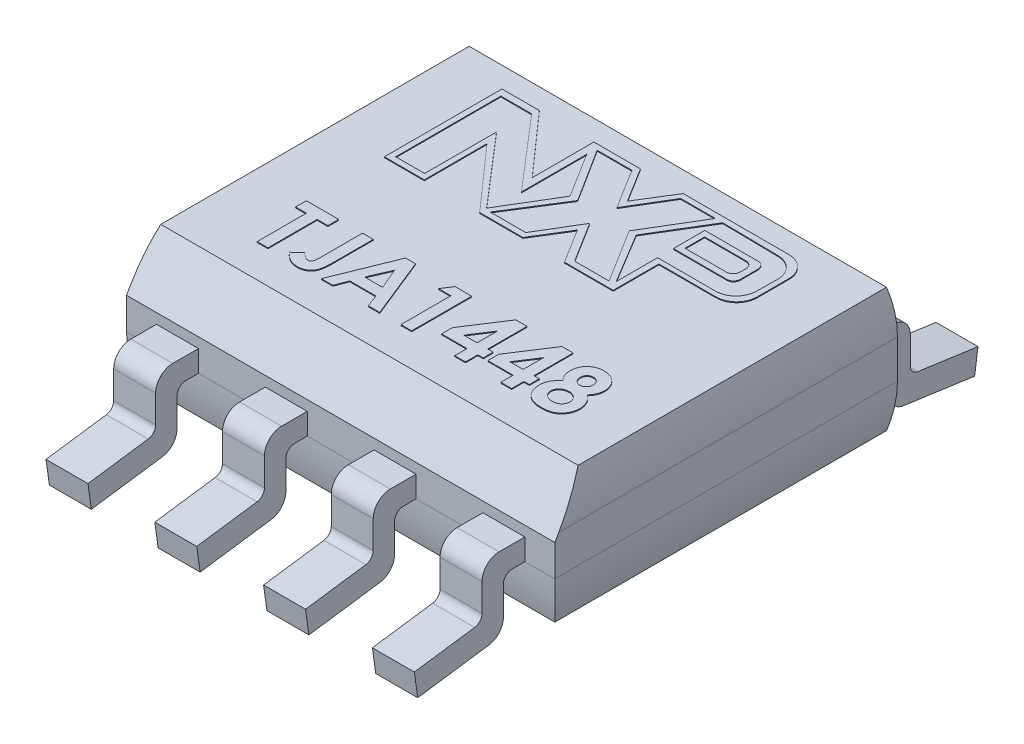
from build123d import *
from OCP.BRepAlgoAPI import BRepAlgoAPI_Cut
from OCP.TopTools import TopTools_ListOfShape

# Parameters (mm, degrees)
SKETCH1_W           = 5
SKETCH1_H           = 4
BOSS_EXTRUDE1_DEPTH = 1.45
CUT_EXTRUDE1_DEPTH  = 61.45
CUT_EXTRUDE2_DEPTH  = 61.45
BOSS_EXTRUDE2_DEPTH = 5
SKETCH7_W           = 0.35
SKETCH7_H           = 1.533953372
SKETCH7_W_2         = 0.78
SKETCH7_H_2         = 1.610570248
SKETCH7_H_3         = 1.782958217
SKETCH7_H_4         = 1.677610014
CUT_EXTRUDE3_DEPTH  = 61.45
BOSS_EXTRUDE3_DEPTH = 0.01
BOSS_EXTRUDE4_DEPTH = 0.01


with BuildPart() as part:
    # Sketch1 → Boss-Extrude1 (new body)
    with BuildSketch(Plane(origin=(0, 0, 0), x_dir=(1, 0, 0), z_dir=(0, 1, 0))):
        Rectangle(SKETCH1_W, SKETCH1_H)
    extrude(amount=BOSS_EXTRUDE1_DEPTH)

    # Sketch2 → Cut-Extrude1 (cut)
    with BuildSketch(Plane.ZY.offset(2.5)):
        Polygon((2, 0.86865368), (1.664359546, 1.45), (1.664359546, 1.731681291), (2.487143748, 1.731681291), (2.487143748, 0.86865368), align=None)
        with BuildLine():
            Line((-1.864420937, 1.672264495), (-2.155873567, 1.672264495))
            Line((-2.155873567, 1.672264495), (-2.155873567, 0.954004167))
            Line((-2.155873567, 0.954004167), (-1.999984404, 0.948389144))
            ThreePointArc((-1.999984404, 0.948389144), (-1.965805293, 1.316619369), (-1.864420937, 1.672264495))
        make_face()
        with BuildLine():
            Line((-1.999984404, 0.501610856), (-2.15587357, 0.501610856))
            Line((-2.15587357, 0.501610856), (-2.15587357, -0.22229559))
            Line((-2.15587357, -0.22229559), (-1.864420937, -0.222264495))
            ThreePointArc((-1.864420937, -0.222264495), (-1.965805293, 0.133380631), (-1.999984404, 0.501610856))
        make_face()
        with BuildLine():
            Line((2, 0.501548667), (2.487143748, 0.501548667))
            Line((2.487143748, 0.501548667), (2.487143748, -0.222291374))
            Line((2.487143748, -0.222291374), (1.864414025, -0.222322469))
            ThreePointArc((1.864414025, -0.222322469), (1.965809439, 0.133319505), (2, 0.501548667))
        make_face()
    extrude(amount=-CUT_EXTRUDE1_DEPTH, mode=Mode.SUBTRACT)


with BuildPart() as cut_extrude2_tool:
    # Sketch5 → Cut-Extrude2 (new body)
    with BuildSketch(Plane(origin=(0, 0, -2), x_dir=(-1, 0, 0), z_dir=(0, 0, -1))):
        with BuildLine():
            Line((-2.655873567, 0.954004878), (-2.499991937, 0.948390126))
            ThreePointArc((-2.499991937, 0.948390126), (-2.46581276, 1.316621068), (-2.364420937, 1.672264066))
            Line((-2.364420937, 1.672264066), (-2.655873567, 1.672264066))
            Line((-2.655873567, 1.672264066), (-2.655873567, 0.954004878))
        make_face()
        with BuildLine():
            ThreePointArc((-2.364420937, -0.222263785), (-2.46581276, 0.133379212), (-2.499991937, 0.501610155))
            Line((-2.499991937, 0.501610155), (-2.655873567, 0.495995403))
            Line((-2.65587357, 0.495995403), (-2.65587357, -0.22229488))
            Line((-2.65587357, -0.22229488), (-2.364420937, -0.222263785))
        make_face()
        with BuildLine():
            ThreePointArc((2.499991937, 0.948390126), (2.46581276, 1.316621068), (2.364420937, 1.672264066))
            Line((2.364420937, 1.672264066), (2.655873567, 1.672264066))
            Line((2.655873567, 1.672264066), (2.655873567, 0.954004878))
            Line((2.655873567, 0.954004878), (2.499991937, 0.948390126))
        make_face()
        with BuildLine():
            Line((2.499991937, 0.501610155), (2.65587357, 0.501610155))
            Line((2.65587357, 0.501610155), (2.65587357, -0.22229488))
            Line((2.65587357, -0.22229488), (2.364420937, -0.222263785))
            ThreePointArc((2.364420937, -0.222263785), (2.46581276, 0.133379212), (2.499991937, 0.501610155))
        make_face()
    extrude(amount=-CUT_EXTRUDE2_DEPTH)


with BuildPart() as part_1:
    add(part.part)

    # Cut-Extrude2: cut by cut_extrude2_tool, with a tolerance
    cut_extrude2_stock = TopTools_ListOfShape()
    cut_extrude2_stock.Append(part_1.part.wrapped)
    cut_extrude2_tools = TopTools_ListOfShape()
    cut_extrude2_tools.Append(cut_extrude2_tool.part.wrapped)
    cut_extrude2_cut = BRepAlgoAPI_Cut()
    cut_extrude2_cut.SetArguments(cut_extrude2_stock)
    cut_extrude2_cut.SetTools(cut_extrude2_tools)
    cut_extrude2_cut.SetFuzzyValue(0.00001)
    cut_extrude2_cut.Build()
    add(Compound.cast(cut_extrude2_cut.Shape()).solids(), mode=Mode.REPLACE)

    # Sketch6 → Boss-Extrude2 (add)
    with BuildSketch(Plane.ZY.offset(2.5)):
        with BuildLine():
            Line((2.300001958, 0.75), (2.253544498, 0.75))
            Line((2.253544498, 0.75), (-2.253544498, 0.75))
            Line((-2.253544498, 0.75), (-2.300001958, 0.75))
            ThreePointArc((-2.300001958, 0.75), (-2.441423314, 0.691421356), (-2.500001958, 0.55))
            Line((-2.500001958, 0.55), (-2.500001958, 0.227578594))
            ThreePointArc((-2.500001958, 0.227578594), (-2.524531, 0.161972691), (-2.586084648, 0.128551787))
            Line((-2.586084648, 0.128551787), (-3.290075098, 0.029612381))
            Line((-3.290075098, 0.029612381), (-3.250778141, -0.25))
            Line((-3.250778141, -0.25), (-2.422167338, -0.133546346))
            ThreePointArc((-2.422167338, -0.133546346), (-2.299060042, -0.066704538), (-2.250001958, 0.064507268))
            Line((-2.250001958, 0.064507268), (-2.250001958, 0.4))
            ThreePointArc((-2.250001958, 0.4), (-2.220712636, 0.470710678), (-2.150001958, 0.5))
            Line((-2.150001958, 0.5), (2.150001958, 0.5))
            ThreePointArc((2.150001958, 0.5), (2.220712636, 0.470710678), (2.250001958, 0.4))
            Line((2.250001958, 0.4), (2.250001958, 0.064507268))
            ThreePointArc((2.250001958, 0.064507268), (2.299060042, -0.066704538), (2.422167338, -0.133546346))
            Line((2.422167338, -0.133546346), (3.250778141, -0.25))
            Line((3.250778141, -0.25), (3.290075098, 0.029612381))
            Line((3.290075098, 0.029612381), (2.586084648, 0.128551787))
            ThreePointArc((2.586084648, 0.128551787), (2.524531, 0.161972691), (2.500001958, 0.227578594))
            Line((2.500001958, 0.227578594), (2.500001958, 0.55))
            ThreePointArc((2.500001958, 0.55), (2.441423314, 0.691421356), (2.300001958, 0.75))
        make_face()
    extrude(amount=-BOSS_EXTRUDE2_DEPTH)

    # Sketch7 → Cut-Extrude3 (cut)
    with BuildSketch(Plane(origin=(0, 1.45, 0), x_dir=(1, 0, 0), z_dir=(0, 1, 0))):
        with Locations((-2.325, -2.766976686)):
            Rectangle(SKETCH7_W, SKETCH7_H)
        with Locations((-1.27, -2.805285124)):
            Rectangle(SKETCH7_W_2, SKETCH7_H_2)
        with Locations((0, -2.805285124)):
            Rectangle(SKETCH7_W_2, SKETCH7_H_2)
        with Locations((2.325, -2.891479109)):
            Rectangle(SKETCH7_W, SKETCH7_H_3)
        with Locations((1.27, -2.838805007)):
            Rectangle(SKETCH7_W_2, SKETCH7_H_4)
        with Locations((1.27, 2.838805007)):
            Rectangle(SKETCH7_W_2, SKETCH7_H_4)
        with Locations((2.325, 2.891479109)):
            Rectangle(SKETCH7_W, SKETCH7_H_3)
        with Locations((0, 2.805285124)):
            Rectangle(SKETCH7_W_2, SKETCH7_H_2)
        with Locations((-1.27, 2.805285124)):
            Rectangle(SKETCH7_W_2, SKETCH7_H_2)
        with Locations((-2.325, 2.766976686)):
            Rectangle(SKETCH7_W, SKETCH7_H)
    extrude(amount=-CUT_EXTRUDE3_DEPTH, mode=Mode.SUBTRACT)

    # Sketch8 → Boss-Extrude3 (add)
    # profile 1 of 2: a face of its own
    with BuildSketch(Plane(origin=(0, 1.45, 0), x_dir=(1, 0, 0), z_dir=(0, 1, 0))):
        with BuildLine():
            Line((-1.803375496, 0.313929244), (-1.803375496, 1.686128651))
            Line((-1.803375496, 1.686128651), (-1.367177563, 1.686128651))
            Line((-1.367177563, 1.686128651), (-0.729512855, 0.965015135))
            Line((-0.729512855, 0.965015135), (-0.729512855, 1.686128651))
            Line((-0.729512855, 1.686128651), (-0.186049825, 1.686128651))
            Line((-0.186049825, 1.686128651), (0.063647762, 1.28357467))
            Line((0.063647762, 1.28357467), (0.31227987, 1.686128651))
            Line((0.31227987, 1.686128651), (1.548664193, 1.686128651))
            ThreePointArc((1.548664193, 1.686128651), (1.71836982, 1.615834278), (1.788664193, 1.446128651))
            Line((1.788664193, 1.446128651), (1.788664193, 1.073244082))
            ThreePointArc((1.788664193, 1.073244082), (1.71836982, 0.903538454), (1.548664193, 0.833244082))
            Line((1.548664193, 0.833244082), (0.881704624, 0.833244082))
            Line((0.881704624, 0.833244082), (0.881704624, 0.299873291))
            Line((0.881704624, 0.299873291), (0.31227987, 0.299873291))
            Line((0.31227987, 0.299873291), (0.063647762, 0.700709541))
            Line((0.063647762, 0.700709541), (-0.179553334, 0.306948774))
            Line((-0.179553334, 0.306948774), (-0.684190472, 0.306948774))
            Line((-0.684190472, 0.306948774), (-1.337736001, 1.046021375))
            Line((-1.337736001, 1.046021375), (-1.337736001, 0.313929244))
            Line((-1.337736001, 0.313929244), (-1.803375496, 0.313929244))
        make_face()
        Polygon((-1.737717167, 0.380080618), (-1.737717167, 1.607932124), (-1.378914568, 1.607932124), (-0.648130736, 0.758975413), (-0.648130736, 1.522116291), (-0.322062078, 0.999645994), (-0.687545107, 0.391434051), (-1.399882226, 1.218961086), (-1.399882226, 0.380080618), align=None, mode=Mode.SUBTRACT)
        Polygon((-0.627925102, 1.622168194), (-0.22215297, 1.622168194), (0.06797424, 1.157765207), (0.346386813, 1.622168194), (0.751426259, 1.622168194), (0.374330406, 0.993157662), (0.764288881, 0.368956019), (0.361905461, 0.368956019), (0.06797424, 0.839448039), (-0.211673984, 0.372983937), (-0.627925102, 0.372983937), (-0.233354138, 0.999645994), align=None, mode=Mode.SUBTRACT)
        with BuildLine():
            Line((0.838091157, 1.622168194), (1.493858319, 1.612977237))
            ThreePointArc((1.493858319, 1.612977237), (1.662562161, 1.540311479), (1.730471342, 1.369637398))
            Line((1.730471342, 1.369637398), (1.727040318, 1.124836692))
            ThreePointArc((1.727040318, 1.124836692), (1.655576174, 0.957309466), (1.487063887, 0.888200101))
            Line((1.487063887, 0.888200101), (0.811207804, 0.888200101))
            Line((0.811207804, 0.888200101), (0.811207804, 0.405870091))
            Line((0.811207804, 0.405870091), (0.45710645, 0.993157662))
            Line((0.45710645, 0.993157662), (0.838091157, 1.622168194))
        make_face(mode=Mode.SUBTRACT)
    # profile 2 of 2: a face of its own
    with BuildSketch(Plane(origin=(0, 1.45, 0), x_dir=(1, 0, 0), z_dir=(0, 1, 0))):
        with BuildLine():
            Line((0.811207804, 1.439616889), (1.43299067, 1.439616889))
            ThreePointArc((1.43299067, 1.439616889), (1.489559213, 1.416185432), (1.51299067, 1.359616889))
            Line((1.51299067, 1.359616889), (1.51299067, 1.153244082))
            ThreePointArc((1.51299067, 1.153244082), (1.489559213, 1.096675539), (1.43299067, 1.073244082))
            Line((1.43299067, 1.073244082), (0.811207804, 1.073244082))
            Line((0.811207804, 1.073244082), (0.811207804, 1.439616889))
        make_face()
        with BuildLine():
            Line((0.875476734, 1.373219945), (1.358258838, 1.373219945))
            ThreePointArc((1.358258838, 1.373219945), (1.41482738, 1.349788487), (1.438258838, 1.293219945))
            Line((1.438258838, 1.293219945), (1.438258838, 1.223991427))
            ThreePointArc((1.438258838, 1.223991427), (1.41482738, 1.167422884), (1.358258838, 1.143991427))
            Line((1.358258838, 1.143991427), (0.875476734, 1.143991427))
            Line((0.875476734, 1.143991427), (0.875476734, 1.373219945))
        make_face(mode=Mode.SUBTRACT)
    extrude(amount=BOSS_EXTRUDE3_DEPTH)

    # Sketch9 → Boss-Extrude4 (add)
    # profile 1 of 7: a face of its own
    with BuildSketch(Plane(origin=(0, 1.45, 0), x_dir=(1, 0, 0), z_dir=(0, 1, 0))):
        Polygon((-1.81434085, -0.586083303), (-1.437417773, -0.586083303), (-1.437417773, -0.711724328), (-1.563058799, -0.711724328), (-1.563058799, -1.286083303), (-1.688699825, -1.286083303), (-1.688699825, -0.711724328), (-1.81434085, -0.711724328), align=None)
    # profile 2 of 7: a face of its own
    with BuildSketch(Plane(origin=(0, 1.45, 0), x_dir=(1, 0, 0), z_dir=(0, 1, 0))):
        with BuildLine():
            Line((-1.159212645, -0.586083303), (-1.03357162, -0.586083303))
            Line((-1.03357162, -0.586083303), (-1.03357162, -1.050786828))
            add(Edge.make_bspline(
                [(-1.03357162, -1.050786828), (-1.033617683, -1.059668569), (-1.033706439, -1.076781931), (-1.034595042, -1.101418854), (-1.03579659, -1.124007236), (-1.037526935, -1.144510882), (-1.040096971, -1.162928802), (-1.043005471, -1.179306946), (-1.046214354, -1.19371205), (-1.051634945, -1.209833603), (-1.060050255, -1.227686389), (-1.072749198, -1.246969934), (-1.088563447, -1.26372405), (-1.106776238, -1.278276935), (-1.127541028, -1.289800068), (-1.150379444, -1.298129019), (-1.175218477, -1.303104792), (-1.192422632, -1.30371689), (-1.201279953, -1.304032021)],
                knots=[0, 0, 0, 0, 1.22248561, 2.355488409, 3.392943897, 4.335991845, 5.186735882, 5.951517034, 6.625683685, 7.215700098, 8.28923535, 9.333114649, 10.380102123, 11.447198135, 12.530158036, 13.633358744, 14.781567393, 16, 16, 16, 16], degree=3))
            add(Edge.make_bspline(
                [(-1.201279953, -1.304032021), (-1.210508476, -1.303746316), (-1.228710727, -1.303182795), (-1.255406203, -1.298383046), (-1.281063892, -1.290687603), (-1.305551055, -1.279560916), (-1.329203174, -1.265623237), (-1.351590985, -1.248334903), (-1.373181914, -1.228232102), (-1.385981148, -1.212805716), (-1.392545979, -1.204893399)],
                knots=[0, 0, 0, 0, 0.990984786, 1.954608977, 2.90473533, 3.862451285, 4.837525908, 5.848096122, 6.896271184, 8, 8, 8, 8], degree=3))
            Line((-1.392545979, -1.204893399), (-1.297473863, -1.116972726))
            add(Edge.make_bspline(
                [(-1.297473863, -1.116972726), (-1.292495995, -1.122601289), (-1.283181064, -1.133133845), (-1.269143738, -1.146868557), (-1.256481314, -1.157902812), (-1.24454484, -1.16586192), (-1.233280675, -1.171472202), (-1.222446464, -1.175513446), (-1.211704488, -1.17780102), (-1.204608011, -1.178197313), (-1.201139729, -1.178390995)],
                knots=[0, 0, 0, 0, 1.529509877, 2.862124173, 3.996688592, 4.944357383, 5.774364335, 6.554177287, 7.293378699, 8, 8, 8, 8], degree=3))
            add(Edge.make_bspline(
                [(-1.201139729, -1.178390995), (-1.197782817, -1.178215937), (-1.19132858, -1.177879359), (-1.182453757, -1.174137867), (-1.174971709, -1.168263568), (-1.170045971, -1.161510298), (-1.166906972, -1.154606639), (-1.164945666, -1.14793319), (-1.163084384, -1.139933535), (-1.161593166, -1.130611681), (-1.160466399, -1.119846038), (-1.159904787, -1.1077673), (-1.159221795, -1.094310196), (-1.159215804, -1.084909241), (-1.159212645, -1.079953495)],
                knots=[0, 0, 0, 0, 1.003927327, 1.930222208, 2.840933547, 3.835773585, 4.407906147, 5.114514582, 5.922289074, 6.876303333, 7.950072246, 9.174518422, 10.510537432, 12, 12, 12, 12], degree=3))
            Line((-1.159212645, -1.079953495), (-1.159212645, -0.586083303))
        make_face()
    # profile 3 of 7: a face of its own
    with BuildSketch(Plane(origin=(0, 1.45, 0), x_dir=(1, 0, 0), z_dir=(0, 1, 0))):
        Polygon((-0.656508318, -0.586083303), (-0.539981876, -0.586083303), (-0.257289568, -1.286083303), (-0.39148428, -1.286083303), (-0.445891331, -1.142493559), (-0.750879312, -1.142493559), (-0.805286363, -1.286083303), (-0.93934085, -1.286083303), align=None)
        Polygon((-0.598315209, -0.773843719), (-0.70320303, -1.016852533), (-0.493427389, -1.016852533), align=None, mode=Mode.SUBTRACT)
    # profile 4 of 7: a face of its own
    with BuildSketch(Plane(origin=(0, 1.45, 0), x_dir=(1, 0, 0), z_dir=(0, 1, 0))):
        Polygon((-0.079064408, -0.586083303), (0.115146329, -0.586083303), (0.115146329, -1.286083303), (-0.010494697, -1.286083303), (-0.010494697, -0.702749969), (-0.15408444, -0.702749969), align=None)
    # profile 5 of 7: a face of its own
    with BuildSketch(Plane(origin=(0, 1.45, 0), x_dir=(1, 0, 0), z_dir=(0, 1, 0))):
        Polygon((0.612381906, -0.568134585), (0.743351457, -0.568134585), (0.743351457, -1.025826892), (0.80617197, -1.025826892), (0.80617197, -1.142493559), (0.743351457, -1.142493559), (0.743351457, -1.286083303), (0.617710432, -1.286083303), (0.617710432, -1.142493559), (0.321556585, -1.142493559), (0.321556585, -1.015310065), align=None)
        Polygon((0.617710432, -1.025826892), (0.617710432, -0.787585706), (0.462762515, -1.025826892), align=None, mode=Mode.SUBTRACT)
    # profile 6 of 7: a face of its own
    with BuildSketch(Plane(origin=(0, 1.45, 0), x_dir=(1, 0, 0), z_dir=(0, 1, 0))):
        Polygon((1.150843444, -0.568134585), (1.281812996, -0.568134585), (1.281812996, -1.025826892), (1.344633509, -1.025826892), (1.344633509, -1.142493559), (1.281812996, -1.142493559), (1.281812996, -1.286083303), (1.15617197, -1.286083303), (1.15617197, -1.142493559), (0.860018124, -1.142493559), (0.860018124, -1.015310065), align=None)
        Polygon((1.15617197, -1.025826892), (1.15617197, -0.787585706), (1.001224053, -1.025826892), align=None, mode=Mode.SUBTRACT)
    # profile 7 of 7: a face of its own
    with BuildSketch(Plane(origin=(0, 1.45, 0), x_dir=(1, 0, 0), z_dir=(0, 1, 0))):
        with BuildLine():
            add(Edge.make_bspline(
                [(1.787181585, -0.909160226), (1.794521967, -0.914405127), (1.80905159, -0.924786935), (1.828239908, -0.943386333), (1.844767739, -0.964134177), (1.858461523, -0.986903204), (1.86943257, -1.011133746), (1.877286175, -1.036566806), (1.882274695, -1.06297806), (1.88281959, -1.080959578), (1.883095047, -1.090049649)],
                knots=[0, 0, 0, 0, 1.013736912, 2.006600758, 2.994453809, 3.989973287, 4.987781207, 5.978959008, 6.978317308, 8, 8, 8, 8], degree=3))
            add(Edge.make_bspline(
                [(1.883095047, -1.090049649), (1.882762729, -1.099892595), (1.882103619, -1.119414817), (1.876276205, -1.148044152), (1.866920525, -1.175548686), (1.854134163, -1.201624839), (1.838102416, -1.225462263), (1.819415924, -1.246565177), (1.798051132, -1.264382442), (1.778159905, -1.27647134), (1.761038831, -1.284501767), (1.747222275, -1.289641079), (1.732632899, -1.294165525), (1.717166597, -1.297780256), (1.700826181, -1.300602147), (1.68363497, -1.302465719), (1.665581648, -1.303820422), (1.653270045, -1.303960298), (1.646957227, -1.304032021)],
                knots=[0, 0, 0, 0, 1.313679292, 2.605514271, 3.884962679, 5.186178731, 6.472827995, 7.711026938, 8.938935107, 10.174644318, 10.808706728, 11.462743532, 12.142127587, 12.847854939, 13.582806024, 14.355735269, 15.156897313, 16, 16, 16, 16], degree=3))
            add(Edge.make_bspline(
                [(1.646957227, -1.304032021), (1.640225232, -1.303940704), (1.627078973, -1.303762381), (1.607888364, -1.302684143), (1.58978595, -1.300696292), (1.572733759, -1.29807944), (1.556748196, -1.294616586), (1.541828788, -1.290225877), (1.527939511, -1.285226566), (1.510938306, -1.277614686), (1.491509012, -1.265727106), (1.470509459, -1.248318087), (1.452077224, -1.227583402), (1.436052141, -1.204105069), (1.423420567, -1.178027529), (1.414027352, -1.150169269), (1.408464578, -1.120605783), (1.407794883, -1.100356248), (1.407454021, -1.090049649)],
                knots=[0, 0, 0, 0, 0.886964665, 1.7320671, 2.531131818, 3.285397207, 4.004107883, 4.684213108, 5.332925796, 5.947568694, 7.135706876, 8.320776993, 9.52873045, 10.778999824, 12.05415135, 13.333578234, 14.642845846, 16, 16, 16, 16], degree=3))
            add(Edge.make_bspline(
                [(1.407454021, -1.090049649), (1.407765512, -1.081058837), (1.408377628, -1.063390802), (1.412762297, -1.037501543), (1.420280673, -1.012955463), (1.430597054, -0.989581681), (1.443899853, -0.967377597), (1.460267735, -0.946506588), (1.47949317, -0.92678037), (1.494072177, -0.91513103), (1.501544566, -0.909160226)],
                knots=[0, 0, 0, 0, 1.01821053, 2.000906977, 2.963938143, 3.919209931, 4.888045165, 5.887808425, 6.917407893, 8, 8, 8, 8], degree=3))
            add(Edge.make_bspline(
                [(1.501544566, -0.909160226), (1.496912081, -0.903817332), (1.487792113, -0.893298783), (1.475990785, -0.876370017), (1.466048663, -0.858916442), (1.457607328, -0.841079702), (1.451367278, -0.822552693), (1.446648362, -0.803626699), (1.443979347, -0.784108905), (1.443562172, -0.770953332), (1.443351457, -0.764308463)],
                knots=[0, 0, 0, 0, 1.061529281, 2.089831458, 3.092927091, 4.075998741, 5.048384512, 6.024008542, 7.00192825, 8, 8, 8, 8], degree=3))
            add(Edge.make_bspline(
                [(1.443351457, -0.764308463), (1.443630833, -0.755313268), (1.444182031, -0.737566096), (1.449063956, -0.71161554), (1.457169136, -0.68695734), (1.468195545, -0.66366369), (1.482197371, -0.642242253), (1.498834571, -0.623032011), (1.518341032, -0.60673663), (1.539991361, -0.592754475), (1.563894079, -0.581633197), (1.589822401, -0.57385136), (1.617463237, -0.568925047), (1.636512477, -0.568402081), (1.646256105, -0.568134585)],
                knots=[0, 0, 0, 0, 1.022455555, 2.017265428, 2.990720743, 3.968117071, 4.939886797, 5.893155559, 6.847550415, 7.820889576, 8.817530429, 9.83499769, 10.892607882, 12, 12, 12, 12], degree=3))
            add(Edge.make_bspline(
                [(1.646256105, -0.568134585), (1.655859399, -0.568402518), (1.674583813, -0.568924933), (1.701738898, -0.573818604), (1.727106904, -0.581773783), (1.750478055, -0.59312988), (1.771904477, -0.607138985), (1.791079411, -0.624001756), (1.807664403, -0.643690459), (1.821782452, -0.665666063), (1.833032368, -0.689341593), (1.841349391, -0.714170301), (1.846160056, -0.739957031), (1.846850376, -0.757465004), (1.847197611, -0.766271604)],
                knots=[0, 0, 0, 0, 1.094655142, 2.134348324, 3.136019022, 4.118575226, 5.088726318, 6.048298823, 7.020513804, 8.015920439, 9.020015034, 10.003048569, 10.995523219, 12, 12, 12, 12], degree=3))
            add(Edge.make_bspline(
                [(1.847197611, -0.766271604), (1.84703034, -0.772495632), (1.846702082, -0.784709823), (1.844275013, -0.802704773), (1.840188126, -0.819970952), (1.83449008, -0.836925612), (1.826567852, -0.854029506), (1.815847234, -0.871610375), (1.802807011, -0.890398709), (1.792565872, -0.902695289), (1.787181585, -0.909160226)],
                knots=[0, 0, 0, 0, 0.940746401, 1.846144481, 2.739104268, 3.619506754, 4.545839139, 5.581956076, 6.728711598, 8, 8, 8, 8], degree=3))
        make_face()
        with BuildLine():
            add(Edge.make_bspline(
                [(1.643171169, -0.69377561), (1.637998265, -0.694024992), (1.627935825, -0.694510095), (1.613577902, -0.698888684), (1.60066966, -0.706050179), (1.589505756, -0.715905804), (1.580350773, -0.727864129), (1.573622363, -0.741612668), (1.569632337, -0.756981747), (1.569209915, -0.767743468), (1.568992483, -0.773282822)],
                knots=[0, 0, 0, 0, 1.018099191, 1.980427864, 2.929421084, 3.909248076, 4.895556904, 5.880788387, 6.909183412, 8, 8, 8, 8], degree=3))
            add(Edge.make_bspline(
                [(1.568992483, -0.773282822), (1.569261078, -0.778869483), (1.569785536, -0.789777978), (1.57390981, -0.805442347), (1.580939748, -0.81963872), (1.590591805, -0.832070582), (1.602320618, -0.842224567), (1.615453293, -0.849979615), (1.630135474, -0.854406772), (1.640338181, -0.85500711), (1.645554983, -0.855314072)],
                knots=[0, 0, 0, 0, 1.07118507, 2.091592095, 3.082435519, 4.092579768, 5.090825648, 6.043203473, 6.999459622, 8, 8, 8, 8], degree=3))
            add(Edge.make_bspline(
                [(1.645554983, -0.855314072), (1.650870411, -0.855076229), (1.661225863, -0.854612866), (1.675944703, -0.850070837), (1.689204497, -0.842806788), (1.700559552, -0.83253703), (1.709965025, -0.820100667), (1.716814814, -0.805656199), (1.720757306, -0.789475021), (1.721283642, -0.778165863), (1.721556585, -0.772301251)],
                knots=[0, 0, 0, 0, 1.008803858, 1.965339183, 2.900766489, 3.864508618, 4.855158575, 5.849593072, 6.884859315, 8, 8, 8, 8], degree=3))
            add(Edge.make_bspline(
                [(1.721556585, -0.772301251), (1.721276738, -0.766765559), (1.720735522, -0.756059725), (1.716854799, -0.740689649), (1.709727657, -0.727155692), (1.700363512, -0.715271626), (1.688623384, -0.705687865), (1.674993955, -0.69863991), (1.659575586, -0.694552028), (1.648757721, -0.694040021), (1.643171169, -0.69377561)],
                knots=[0, 0, 0, 0, 1.065910571, 2.061433587, 3.023559535, 3.990682701, 4.956464619, 5.918590567, 6.925120432, 8, 8, 8, 8], degree=3))
        make_face(mode=Mode.SUBTRACT)
        with BuildLine():
            add(Edge.make_bspline(
                [(1.647237675, -0.980955097), (1.64330666, -0.981020378), (1.635558679, -0.981149045), (1.624168509, -0.982632765), (1.613238471, -0.984843877), (1.602782125, -0.987894042), (1.592852295, -0.992052185), (1.58336481, -0.997064903), (1.574352434, -1.002982869), (1.565948848, -1.009698641), (1.55835397, -1.017069841), (1.551507878, -1.024757764), (1.545912164, -1.032961163), (1.541252269, -1.041407354), (1.537508017, -1.05016327), (1.535032783, -1.059373102), (1.533439079, -1.068914201), (1.533210399, -1.07541321), (1.533095047, -1.078691476)],
                knots=[0, 0, 0, 0, 1.129580664, 2.226389355, 3.296443603, 4.333934503, 5.352185725, 6.386189251, 7.41493955, 8.447544828, 9.47401038, 10.455044306, 11.4018853, 12.322125673, 13.225630306, 14.132028716, 15.057747923, 16, 16, 16, 16], degree=3))
            add(Edge.make_bspline(
                [(1.533095047, -1.078691476), (1.533150026, -1.082110383), (1.533259069, -1.088891362), (1.53490602, -1.098788748), (1.537277338, -1.108334098), (1.540607929, -1.11743806), (1.545061963, -1.126095335), (1.55038016, -1.13439009), (1.556747964, -1.14226416), (1.563992713, -1.149675329), (1.572103178, -1.156361526), (1.580844482, -1.162252182), (1.590101172, -1.167445685), (1.600151127, -1.171186252), (1.610622158, -1.174609948), (1.621794787, -1.176687022), (1.633546983, -1.17821539), (1.641576399, -1.178331457), (1.645695207, -1.178390995)],
                knots=[0, 0, 0, 0, 0.973817353, 1.931446211, 2.852767904, 3.776304432, 4.688323523, 5.623710549, 6.581246645, 7.570897993, 8.57436511, 9.572506873, 10.574556662, 11.591826551, 12.624694332, 13.712108235, 14.826391851, 16, 16, 16, 16], degree=3))
            add(Edge.make_bspline(
                [(1.645695207, -1.178390995), (1.64985871, -1.178315526), (1.657972058, -1.178168462), (1.669832141, -1.176868695), (1.681049674, -1.174806341), (1.69161126, -1.171856696), (1.701556836, -1.168078082), (1.710752991, -1.163268655), (1.719409689, -1.157818236), (1.727248747, -1.151450516), (1.734406384, -1.14451103), (1.740573693, -1.136905944), (1.745817688, -1.12887981), (1.750047541, -1.120345905), (1.753460652, -1.111344512), (1.755801833, -1.101785879), (1.757254619, -1.091777422), (1.75738684, -1.08495991), (1.757454021, -1.081495963)],
                knots=[0, 0, 0, 0, 1.200705402, 2.339794563, 3.437264955, 4.487414319, 5.499029866, 6.500076882, 7.476298407, 8.444948224, 9.407950986, 10.347155707, 11.263432813, 12.167927724, 13.089546445, 14.03463663, 15.00140776, 16, 16, 16, 16], degree=3))
            add(Edge.make_bspline(
                [(1.757454021, -1.081495963), (1.757325745, -1.07798673), (1.757075011, -1.071127395), (1.755703026, -1.060997973), (1.753129323, -1.051395124), (1.749762168, -1.042096132), (1.745283078, -1.033293424), (1.739722386, -1.025005578), (1.733392952, -1.017027296), (1.725995243, -1.00971374), (1.717906999, -1.003026551), (1.709298352, -0.997069), (1.700195817, -0.992023503), (1.690574498, -0.98789906), (1.680399239, -0.984842289), (1.669747678, -0.982632843), (1.658637288, -0.981148713), (1.651075343, -0.981020278), (1.647237675, -0.980955097)],
                knots=[0, 0, 0, 0, 1.011708178, 1.977538892, 2.938094892, 3.871441737, 4.823268678, 5.775953079, 6.743660653, 7.753304209, 8.767430709, 9.76505158, 10.765940967, 11.761741361, 12.775867861, 13.822051386, 14.89469657, 16, 16, 16, 16], degree=3))
        make_face(mode=Mode.SUBTRACT)
    extrude(amount=BOSS_EXTRUDE4_DEPTH)


solid = part_1.part
